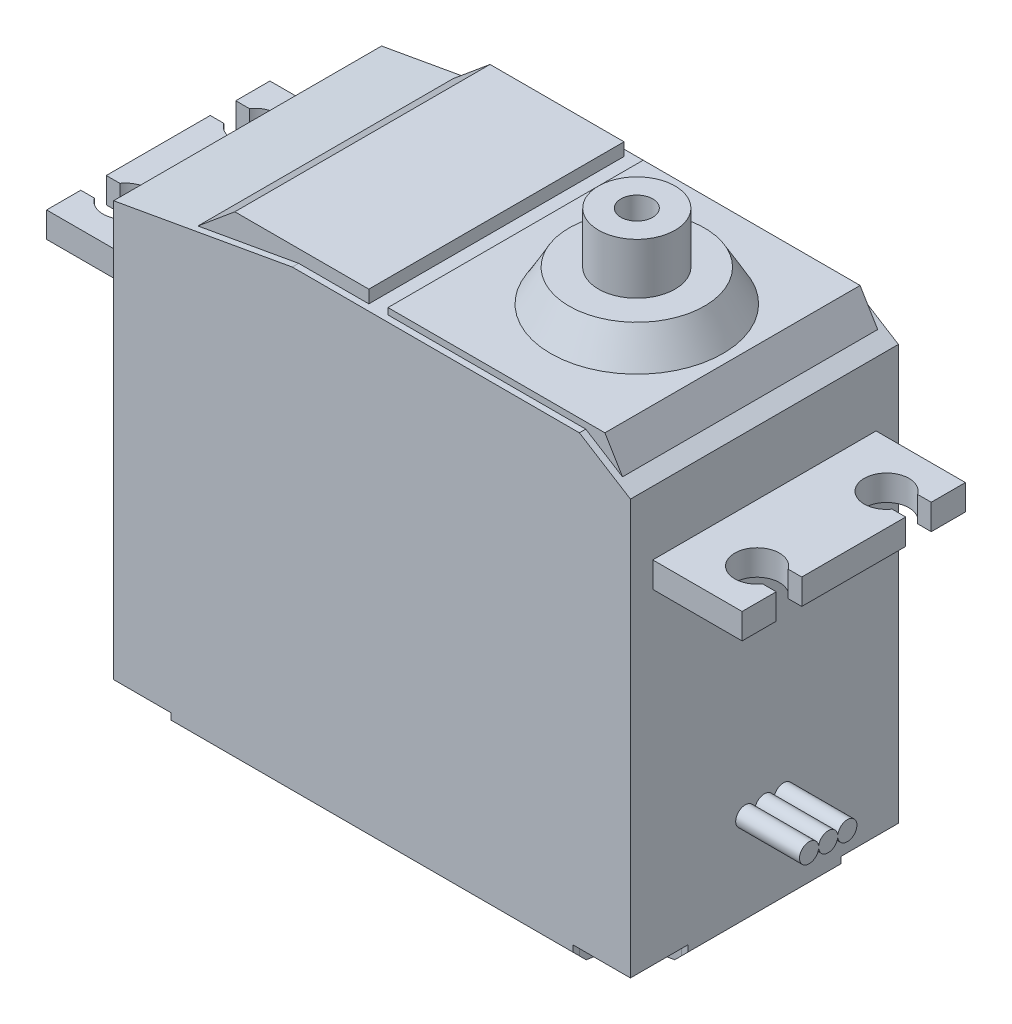
from build123d import *

# Parameters (mm, degrees)
SKETCH1_W           = 41.148
SKETCH1_H           = 21.336
BOSS_EXTRUDE1_DEPTH = 37.084
CHAMFER1_SIZE       = 2.54
CHAMFER1_SIZE2      = 14.224
CHAMFER2_SIZE       = 2.54
CHAMFER2_SIZE2      = 4.064
SKETCH3_W           = 18.796
SKETCH3_H           = 20.32
BOSS_EXTRUDE2_DEPTH = 2.54
CHAMFER3_SIZE       = 2.54
CHAMFER3_SIZE_2     = 1.524
SKETCH4_W           = 13.716
SKETCH4_H           = 20.32
BOSS_EXTRUDE3_DEPTH = 3.556
CHAMFER4_SIZE       = 2.54
CHAMFER4_SIZE_2     = 3.048
SKETCH5_R           = 6.858
BOSS_EXTRUDE4_DEPTH = 2.54
BOSS_EXTRUDE4_TAPER = 30
SKETCH6_R           = 3.048
SKETCH6_R_2         = 1.27
BOSS_EXTRUDE5_DEPTH = 4.064
BOSS_EXTRUDE6_DEPTH = 2.032
CHAMFER5_SIZE       = 1.016
CUT_EXTRUDE1_DEPTH  = 1.524
BOSS_EXTRUDE7_DEPTH = 5.08


with BuildPart() as part:
    # Sketch1 → Boss-Extrude1 (new body)
    with BuildSketch(Plane(origin=(0, 0, 0), x_dir=(1, 0, 0), z_dir=(0, 1, 0))):
        with Locations((-8.942205534, 0.674656126)):
            Rectangle(SKETCH1_W, SKETCH1_H)
    extrude(amount=BOSS_EXTRUDE1_DEPTH)

    # Chamfer1
    chamfer1_edges = [part.edges().sort_by_distance(p)[0] for p in [
        (-29.516205534, 37.084, -0.674656126),
    ]]
    chamfer1_side = [part.faces().sort_by_distance(p)[0] for p in [
        (-29.516205534, 18.542, -0.674656126),
    ]]
    chamfer(chamfer1_edges, length=CHAMFER1_SIZE, length2=CHAMFER1_SIZE2, reference=chamfer1_side[0])

    # Chamfer2
    chamfer2_edges = [part.edges().sort_by_distance(p)[0] for p in [
        (11.631794466, 37.084, -0.674656126),
    ]]
    chamfer2_side = [part.faces().sort_by_distance(p)[0] for p in [
        (11.631794466, 18.542, -0.674656126),
    ]]
    chamfer(chamfer2_edges, length=CHAMFER2_SIZE, length2=CHAMFER2_SIZE2, reference=chamfer2_side[0])

    # Sketch3 → Boss-Extrude2 (add)
    with BuildSketch(Plane(origin=(0, 35.052, 0), x_dir=(1, 0, 0), z_dir=(0, 1, 0))):
        with Locations((1.217794466, 0.674656126)):
            Rectangle(SKETCH3_W, SKETCH3_H)
    extrude(amount=BOSS_EXTRUDE2_DEPTH)

    # Chamfer3
    # the kernel refuses this chamfer: 2.54, 1.524 mm, written as the material it takes off along each edge
    with BuildSketch(Plane(origin=(10.615794466, 37.592, -17.403759313), x_dir=(0.019893418958582338, -0.9998021063601228, 0), z_dir=(0, 0, 1))) as chamfer3_piece_1_section:
        Polygon((CHAMFER3_SIZE * 0.99980210636, -CHAMFER3_SIZE * 0.0198934189586), (-CHAMFER3_SIZE_2 * 0.0198934189586, -CHAMFER3_SIZE_2 * 0.99980210636), (0, 0), align=None)
    chamfer3_piece_1 = extrude(amount=33.458206374, mode=Mode.PRIVATE)
    chamfer3_piece_1 = split(chamfer3_piece_1, bisect_by=Plane(origin=(9.549275809, 35.845574161, -0.674656126), z_dir=(0.5299989400031799, 0.8479983040050881, 0)), keep=Keep.TOP, mode=Mode.PRIVATE)
    add(chamfer3_piece_1, mode=Mode.SUBTRACT)

    # Sketch4 → Boss-Extrude3 (add)
    with BuildSketch(Plane(origin=(0, 34.544, 0), x_dir=(1, 0, 0), z_dir=(0, 1, 0))):
        with Locations((-16.562205534, 0.674656126)):
            Rectangle(SKETCH4_W, SKETCH4_H)
    extrude(amount=BOSS_EXTRUDE3_DEPTH)

    # Chamfer4
    # the kernel refuses this chamfer: 3.048, 2.54 mm, written as the material it takes off along each edge
    with BuildSketch(Plane(origin=(-23.420205534, 38.1, 17.341921223), x_dir=(-0.03575241599375306, -0.9993606780090006, 0), z_dir=(0, 0, -1))) as chamfer4_piece_1_section:
        Polygon((CHAMFER4_SIZE * 0.999360678009, -CHAMFER4_SIZE * 0.0357524159938), (-CHAMFER4_SIZE_2 * 0.0357524159938, -CHAMFER4_SIZE_2 * 0.999360678009), (0, 0), align=None)
    chamfer4_piece_1 = extrude(amount=36.0331547, mode=Mode.PRIVATE)
    chamfer4_piece_1 = split(chamfer4_piece_1, bisect_by=Plane(origin=(-22.151753268, 35.859080762, -0.674656126), z_dir=(-0.17579063848365747, 0.984427575508482, 0)), keep=Keep.TOP, mode=Mode.PRIVATE)
    add(chamfer4_piece_1, mode=Mode.SUBTRACT)

    # Sketch5 → Boss-Extrude4 (add)
    with BuildSketch(Plane(origin=(0, 37.592, 0), x_dir=(1, 0, 0), z_dir=(0, 1, 0))):
        with Locations((1.471794466, 0.674656126)):
            Circle(SKETCH5_R)
    extrude(amount=BOSS_EXTRUDE4_DEPTH, taper=BOSS_EXTRUDE4_TAPER)

    # Sketch6 → Boss-Extrude5 (add)
    with BuildSketch(Plane(origin=(0, 40.132, 0), x_dir=(1, 0, 0), z_dir=(0, 1, 0))):
        with Locations(Location((1.471794466, 0.674656126, 0), (0, 0, 270))):
            Circle(SKETCH6_R)
        with Locations(Location((1.471794466, 0.674656126, 0), (0, 0, 270))):
            Circle(SKETCH6_R_2, mode=Mode.SUBTRACT)
    extrude(amount=BOSS_EXTRUDE5_DEPTH)

    # Sketch7 → Boss-Extrude6 (add)
    with BuildSketch(Plane(origin=(0, 27.432, 0), x_dir=(-1, 0, 0), z_dir=(0, -1, 0))):
        with BuildLine():
            Line((29.516205534, 9.564656126), (36.628205534, 9.564656126))
            Line((36.628205534, 9.564656126), (36.628205534, 6.84497112))
            Line((36.628205534, 6.84497112), (35.547324446, 6.84497112))
            ThreePointArc((35.547324446, 6.84497112), (32.310205534, 5.82897112), (35.547324446, 4.81297112))
            Line((35.547324446, 4.81297112), (36.628205534, 4.81297112))
            Line((36.628205534, 4.81297112), (36.628205534, -3.463658867))
            Line((36.628205534, -3.463658867), (35.547324446, -3.463658867))
            ThreePointArc((35.547324446, -3.463658867), (32.310205534, -4.479658867), (35.547324446, -5.495658867))
            Line((35.547324446, -5.495658867), (36.628205534, -5.495658867))
            Line((36.628205534, -5.495658867), (36.628205534, -8.215343874))
            Line((36.628205534, -8.215343874), (29.516205534, -8.215343874))
            Line((29.516205534, -8.215343874), (29.516205534, 9.564656126))
        make_face()
    boss_extrude6 = extrude(amount=-BOSS_EXTRUDE6_DEPTH)

    # Mirror1: Boss-Extrude6 across plane
    add(boss_extrude6.mirror(Plane(origin=(-8.942205534, 0, 0), x_dir=(0, 0, 1), z_dir=(1, 0, 0))))

    # Chamfer5
    chamfer5_edges = [part.edges().sort_by_distance(p)[0] for p in [
        (-8.942205534, 0, -11.342656126),
        (11.631794466, 0, -0.674656126),
        (-8.942205534, 0, 9.993343874),
        (-29.516205534, 0, -0.674656126),
    ]]
    chamfer(chamfer5_edges, length=CHAMFER5_SIZE)

    # Sketch8 → Cut-Extrude1 (cut)
    with BuildSketch(Plane.XZ):
        with BuildLine():
            Line((-29.516205534, 9.993343874), (-24.944205534, 9.993343874))
            Line((-24.944205534, 9.993343874), (-24.944205534, 9.485343874))
            ThreePointArc((-24.944205534, 9.485343874), (-26.134523575, 6.611661915), (-29.008205534, 5.421343874))
            Line((-29.008205534, 5.421343874), (-29.516205534, 5.421343874))
            Line((-29.516205534, 5.421343874), (-29.516205534, 9.993343874))
        make_face()
        with BuildLine():
            Line((-29.516205534, -11.342656126), (-29.516205534, -6.770656126))
            Line((-29.516205534, -6.770656126), (-29.008205534, -6.770656126))
            ThreePointArc((-29.008205534, -6.770656126), (-26.134523575, -7.960974168), (-24.944205534, -10.834656126))
            Line((-24.944205534, -10.834656126), (-24.944205534, -11.342656126))
            Line((-24.944205534, -11.342656126), (-29.516205534, -11.342656126))
        make_face()
        with BuildLine():
            Line((11.631794466, -11.342656126), (7.059794466, -11.342656126))
            Line((7.059794466, -11.342656126), (7.059794466, -10.834656126))
            ThreePointArc((7.059794466, -10.834656126), (8.250112508, -7.960974168), (11.123794466, -6.770656126))
            Line((11.123794466, -6.770656126), (11.631794466, -6.770656126))
            Line((11.631794466, -6.770656126), (11.631794466, -11.342656126))
        make_face()
        with BuildLine():
            Line((11.631794466, 9.993343874), (11.631794466, 5.421343874))
            Line((11.631794466, 5.421343874), (11.123794466, 5.421343874))
            ThreePointArc((11.123794466, 5.421343874), (8.250112508, 6.611661915), (7.059794466, 9.485343874))
            Line((7.059794466, 9.485343874), (7.059794466, 9.993343874))
            Line((7.059794466, 9.993343874), (11.631794466, 9.993343874))
        make_face()
    extrude(amount=-CUT_EXTRUDE1_DEPTH, mode=Mode.SUBTRACT)

    # Sketch9 → Boss-Extrude7 (add)
    with BuildSketch(Plane(origin=(11.631794466, 0, 0), x_dir=(0, 0, -1), z_dir=(1, 0, 0))):
        with BuildLine():
            Line((-0.098001741, 8.255), (-0.076686006, 8.255))
            ThreePointArc((-0.076686006, 8.255), (0.674656126, 8.89), (1.425998259, 8.255))
            Line((1.425998259, 8.255), (1.447313994, 8.255))
            ThreePointArc((1.447313994, 8.255), (2.960656126, 8.128), (1.447313994, 8.001))
            Line((1.447313994, 8.001), (1.425998259, 8.001))
            ThreePointArc((1.425998259, 8.001), (0.674656126, 7.366), (-0.076686006, 8.001))
            Line((-0.076686006, 8.001), (-0.098001741, 8.001))
            ThreePointArc((-0.098001741, 8.001), (-1.611343874, 8.128), (-0.098001741, 8.255))
        make_face()
    extrude(amount=BOSS_EXTRUDE7_DEPTH)


solid = part.part
